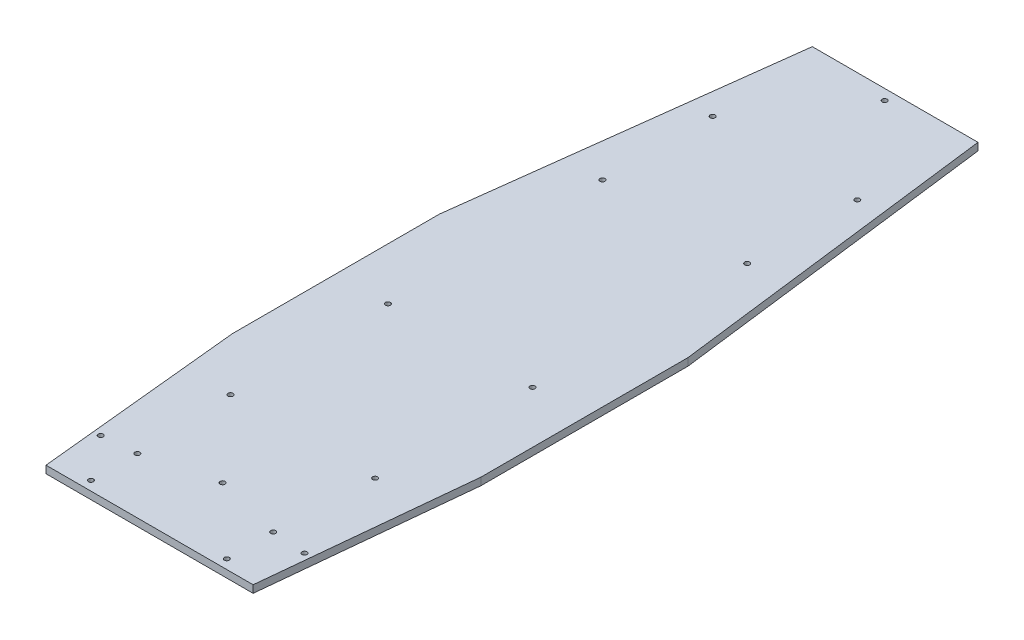
from build123d import *

# Parameters (mm, degrees)
BOSS_EXTRUDE1_DEPTH                = 9
F_6_0_6_DIAMETER_HOLE1_AT_2_COUNT  = 2
F_6_0_6_DIAMETER_HOLE1_AT_2_PITCH  = 148.638420336
F_6_0_6_DIAMETER_HOLE1_AT_3_COUNT  = 2
F_6_0_6_DIAMETER_HOLE1_AT_3_PITCH  = 267.921966251
F_6_0_6_DIAMETER_HOLE1_AT_4_COUNT  = 2
F_6_0_6_DIAMETER_HOLE1_AT_4_PITCH  = 267.921966251
F_6_0_6_DIAMETER_HOLE1_AT_5_COUNT  = 2
F_6_0_6_DIAMETER_HOLE1_AT_5_PITCH  = 148.638420336
F_6_0_6_DIAMETER_HOLE1_AT_6_COUNT  = 2
F_6_0_6_DIAMETER_HOLE1_AT_6_PITCH  = 519.685077715
F_6_0_6_DIAMETER_HOLE1_AT_7_COUNT  = 2
F_6_0_6_DIAMETER_HOLE1_AT_7_PITCH  = 519.685077715
F_6_0_6_DIAMETER_HOLE1_AT_8_COUNT  = 2
F_6_0_6_DIAMETER_HOLE1_AT_8_PITCH  = 707.705150469
F_6_0_6_DIAMETER_HOLE1_AT_9_COUNT  = 2
F_6_0_6_DIAMETER_HOLE1_AT_9_PITCH  = 707.705150469
F_6_0_6_DIAMETER_HOLE1_AT_10_COUNT = 2
F_6_0_6_DIAMETER_HOLE1_AT_10_PITCH = 799.1
F_6_0_6_DIAMETER_HOLE3_D           = 6
F_6_0_6_DIAMETER_HOLE3_DEPTH       = 34.5
F_6_0_6_DIAMETER_HOLE3_TIP         = 1.802581857
F_6_0_6_DIAMETER_HOLE4_AT_2_COUNT  = 2
F_6_0_6_DIAMETER_HOLE4_AT_2_PITCH  = 246
F_6_0_6_DIAMETER_HOLE5_AT_2_COUNT  = 2
F_6_0_6_DIAMETER_HOLE5_AT_2_PITCH  = 56
F_6_0_6_DIAMETER_HOLE5_AT_3_COUNT  = 2
F_6_0_6_DIAMETER_HOLE5_AT_3_PITCH  = 164
F_6_0_6_DIAMETER_HOLE5_AT_4_COUNT  = 2
F_6_0_6_DIAMETER_HOLE5_AT_4_PITCH  = 173.297432179


with BuildPart() as part:
    # Sketch1 → Boss-Extrude1 (new body)
    with BuildSketch(Plane(origin=(0, 0, 0), x_dir=(1, 0, 0), z_dir=(0, 1, 0))):
        Polygon((-150, -125), (-150, 125), (-100, 525), (100, 525), (150, 125), (150, -125), (125, -375), (-125, -375), align=None)
    extrude(amount=BOSS_EXTRUDE1_DEPTH)

    # Sketch5 → Ø6.0 (6) Diameter Hole1 (revolve, cut)
    with BuildSketch(Plane(origin=(0, 9, -512.3), x_dir=(0, 0, 1), z_dir=(1, 0, 0))):
        Polygon((0, 0), (0, 9), (6, 9), (3, 6), (3, 0), align=None)
    f_6_0_6_diameter_hole1 = revolve(axis=Axis((0, 15.35, -512.3), (0, -1, 0)), mode=Mode.SUBTRACT)

    # Ø6.0 (6) Diameter Hole1 at 2: Ø6.0 (6) Diameter Hole1 ×2
    with Locations(*[Vector(-0.5873313225653228, 0, 0.8093465991364076) * (i * F_6_0_6_DIAMETER_HOLE1_AT_2_PITCH) for i in range(1, F_6_0_6_DIAMETER_HOLE1_AT_2_COUNT)]):
        add(f_6_0_6_diameter_hole1, mode=Mode.SUBTRACT)

    # Ø6.0 (6) Diameter Hole1 at 3: Ø6.0 (6) Diameter Hole1 ×2
    with Locations(*[Vector(-0.32584114405197145, 0, 0.945424533658241) * (i * F_6_0_6_DIAMETER_HOLE1_AT_3_PITCH) for i in range(1, F_6_0_6_DIAMETER_HOLE1_AT_3_COUNT)]):
        add(f_6_0_6_diameter_hole1, mode=Mode.SUBTRACT)

    # Ø6.0 (6) Diameter Hole1 at 4: Ø6.0 (6) Diameter Hole1 ×2
    with Locations(*[Vector(0.32584114405197206, 0, 0.9454245336582408) * (i * F_6_0_6_DIAMETER_HOLE1_AT_4_PITCH) for i in range(1, F_6_0_6_DIAMETER_HOLE1_AT_4_COUNT)]):
        add(f_6_0_6_diameter_hole1, mode=Mode.SUBTRACT)

    # Ø6.0 (6) Diameter Hole1 at 5: Ø6.0 (6) Diameter Hole1 ×2
    with Locations(*[Vector(0.5873313225653236, 0, 0.8093465991364069) * (i * F_6_0_6_DIAMETER_HOLE1_AT_5_PITCH) for i in range(1, F_6_0_6_DIAMETER_HOLE1_AT_5_COUNT)]):
        add(f_6_0_6_diameter_hole1, mode=Mode.SUBTRACT)

    # Ø6.0 (6) Diameter Hole1 at 6: Ø6.0 (6) Diameter Hole1 ×2
    with Locations(*[Vector(0.1679863512413935, 0, 0.9857893212023567) * (i * F_6_0_6_DIAMETER_HOLE1_AT_6_PITCH) for i in range(1, F_6_0_6_DIAMETER_HOLE1_AT_6_COUNT)]):
        add(f_6_0_6_diameter_hole1, mode=Mode.SUBTRACT)

    # Ø6.0 (6) Diameter Hole1 at 7: Ø6.0 (6) Diameter Hole1 ×2
    with Locations(*[Vector(-0.16798635124139308, 0, 0.9857893212023567) * (i * F_6_0_6_DIAMETER_HOLE1_AT_7_PITCH) for i in range(1, F_6_0_6_DIAMETER_HOLE1_AT_7_COUNT)]):
        add(f_6_0_6_diameter_hole1, mode=Mode.SUBTRACT)

    # Ø6.0 (6) Diameter Hole1 at 8: Ø6.0 (6) Diameter Hole1 ×2
    with Locations(*[Vector(-0.12335645705302023, 0, 0.9923624259832324) * (i * F_6_0_6_DIAMETER_HOLE1_AT_8_PITCH) for i in range(1, F_6_0_6_DIAMETER_HOLE1_AT_8_COUNT)]):
        add(f_6_0_6_diameter_hole1, mode=Mode.SUBTRACT)

    # Ø6.0 (6) Diameter Hole1 at 9: Ø6.0 (6) Diameter Hole1 ×2
    with Locations(*[Vector(0.12335645705302056, 0, 0.9923624259832323) * (i * F_6_0_6_DIAMETER_HOLE1_AT_9_PITCH) for i in range(1, F_6_0_6_DIAMETER_HOLE1_AT_9_COUNT)]):
        add(f_6_0_6_diameter_hole1, mode=Mode.SUBTRACT)

    # Ø6.0 (6) Diameter Hole1 at 10: Ø6.0 (6) Diameter Hole1 ×2
    with Locations(*[(0, 0, i * F_6_0_6_DIAMETER_HOLE1_AT_10_PITCH) for i in range(1, F_6_0_6_DIAMETER_HOLE1_AT_10_COUNT)]):
        add(f_6_0_6_diameter_hole1, mode=Mode.SUBTRACT)

    # Ø6.0 (6) Diameter Hole3
    with Locations(Plane(origin=(0, 0, -512.3), x_dir=(0, 0, -1), z_dir=(0, -1, 0))):
        with Locations((0, 0), (-120.3, 87.3), (-120.3, -87.3), (-253.3, -87.3), (-253.3, 87.3), (-512.3, 87.3), (-512.3, -87.3), (-702.3, -87.3), (-702.3, 87.3), (-799.1, 0)):
            Hole(F_6_0_6_DIAMETER_HOLE3_D / 2, depth=F_6_0_6_DIAMETER_HOLE3_DEPTH)
            with Locations((0, 0, -(F_6_0_6_DIAMETER_HOLE3_DEPTH + F_6_0_6_DIAMETER_HOLE3_TIP / 2))):  # 118° drill point
                Cone(0, F_6_0_6_DIAMETER_HOLE3_D / 2, F_6_0_6_DIAMETER_HOLE3_TIP, mode=Mode.SUBTRACT)

    # Sketch10 → Ø6.0 (6) Diameter Hole4 (revolve, cut)
    with BuildSketch(Plane(origin=(123, 9, 311), x_dir=(0, 0, 1), z_dir=(1, 0, 0))):
        Polygon((0, 0), (0, 9), (6, 9), (3, 6), (3, 0), align=None)
    f_6_0_6_diameter_hole4 = revolve(axis=Axis((123, 15.35, 311), (0, -1, 0)), mode=Mode.SUBTRACT)

    # Ø6.0 (6) Diameter Hole4 at 2: Ø6.0 (6) Diameter Hole4 ×2
    with Locations(*[(-i * F_6_0_6_DIAMETER_HOLE4_AT_2_PITCH, 0, 0) for i in range(1, F_6_0_6_DIAMETER_HOLE4_AT_2_COUNT)]):
        add(f_6_0_6_diameter_hole4, mode=Mode.SUBTRACT)

    # Sketch12 → Ø6.0 (6) Diameter Hole5 (revolve, cut)
    with BuildSketch(Plane(origin=(-82, 9, 363.75), x_dir=(0, 0, 1), z_dir=(1, 0, 0))):
        Polygon((0, 0), (0, 9), (6, 9), (3, 6), (3, 0), align=None)
    f_6_0_6_diameter_hole5 = revolve(axis=Axis((-82, 15.35, 363.75), (0, -1, 0)), mode=Mode.SUBTRACT)

    # Ø6.0 (6) Diameter Hole5 at 2: Ø6.0 (6) Diameter Hole5 ×2
    with Locations(*[(0, 0, -i * F_6_0_6_DIAMETER_HOLE5_AT_2_PITCH) for i in range(1, F_6_0_6_DIAMETER_HOLE5_AT_2_COUNT)]):
        add(f_6_0_6_diameter_hole5, mode=Mode.SUBTRACT)

    # Ø6.0 (6) Diameter Hole5 at 3: Ø6.0 (6) Diameter Hole5 ×2
    with Locations(*[(i * F_6_0_6_DIAMETER_HOLE5_AT_3_PITCH, 0, 0) for i in range(1, F_6_0_6_DIAMETER_HOLE5_AT_3_COUNT)]):
        add(f_6_0_6_diameter_hole5, mode=Mode.SUBTRACT)

    # Ø6.0 (6) Diameter Hole5 at 4: Ø6.0 (6) Diameter Hole5 ×2
    with Locations(*[Vector(0.9463498560679912, 0, -0.32314385329152157) * (i * F_6_0_6_DIAMETER_HOLE5_AT_4_PITCH) for i in range(1, F_6_0_6_DIAMETER_HOLE5_AT_4_COUNT)]):
        add(f_6_0_6_diameter_hole5, mode=Mode.SUBTRACT)


solid = part.part
